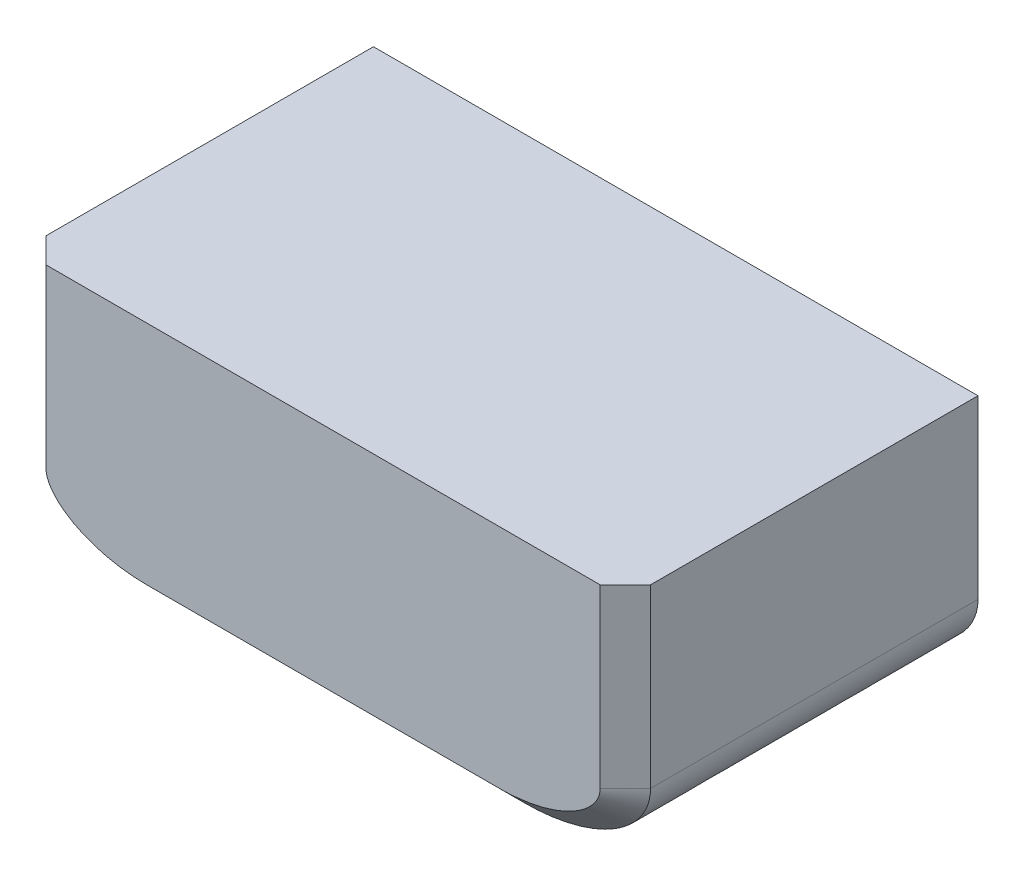
from build123d import *

# Parameters (mm, degrees)
SKIZZE1_W                          = 24
SKIZZE1_H                          = 10
AUFSATZ_LINEAR_AUSTRAGEN1_DEPTH    = 7
F_4_0_4_DURCHMESSER_BOHRUNG1_D     = 4
F_4_0_4_DURCHMESSER_BOHRUNG1_DEPTH = 5
F_4_0_4_DURCHMESSER_BOHRUNG1_TIP   = 1.201721238
VERRUNDUNG1_SIZE                   = 5
VERRUNDUNG1_SIZE_2                 = 3
FASE2_SIZE                         = 1


with BuildPart() as part:
    # Skizze1 → Aufsatz-Linear austragen1 (new, symmetric)
    with BuildSketch(Plane.XY):
        Rectangle(SKIZZE1_W, SKIZZE1_H)
    extrude(amount=AUFSATZ_LINEAR_AUSTRAGEN1_DEPTH, both=True)

    # Ø4.0 (4) Durchmesser Bohrung1
    with Locations(Plane(origin=(0, 0, -7), x_dir=(-1, 0, 0), z_dir=(0, 0, -1))):
        with Locations((-5.5, 0), (5.5, 0)):
            Hole(F_4_0_4_DURCHMESSER_BOHRUNG1_D / 2, depth=F_4_0_4_DURCHMESSER_BOHRUNG1_DEPTH)
            with Locations((0, 0, -(F_4_0_4_DURCHMESSER_BOHRUNG1_DEPTH + F_4_0_4_DURCHMESSER_BOHRUNG1_TIP / 2))):  # 118° drill point
                Cone(0, F_4_0_4_DURCHMESSER_BOHRUNG1_D / 2, F_4_0_4_DURCHMESSER_BOHRUNG1_TIP, mode=Mode.SUBTRACT)

    # Verrundung1
    # an asymmetric fillet: 5, 3 mm, written as the material it takes off along each edge
    with BuildSketch(Plane(origin=(12, -5, -19.5), x_dir=(-1, 0, 0), z_dir=(0, 0, 1)), Plane(origin=(-12, -5, 19.5), x_dir=(1, 0, 0), z_dir=(0, 0, -1))) as verrundung1_piece_1:
        with BuildLine():
            Bezier((VERRUNDUNG1_SIZE, 0), (0, 0), (0, -VERRUNDUNG1_SIZE_2), weights=[1, 0.707106781, 1])
            Line((0, -VERRUNDUNG1_SIZE_2), (0, 0))
            Line((0, 0), (VERRUNDUNG1_SIZE, 0))
        make_face()
    extrude(amount=39, mode=Mode.SUBTRACT)

    # Fase2
    fase2_edges = [part.edges().sort_by_distance(p)[0] for p in [
        (12, 1.5, 7),
        (10.099176713, -4.354195674, 7),
        (0, -5, 7),
        (-10.099176713, -4.354195674, 7),
        (-12, 1.5, 7),
    ]]
    chamfer(fase2_edges, length=FASE2_SIZE)


solid = part.part
